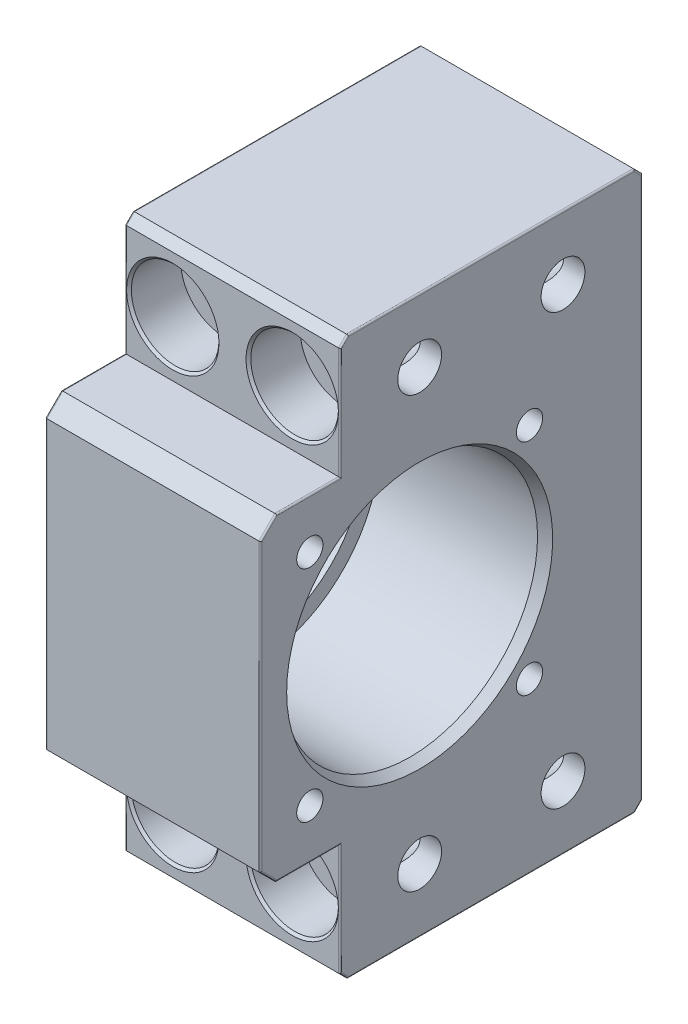
from build123d import *

# Parameters (mm, degrees)
SKETCH1_W                                    = 70
SKETCH1_H                                    = 48
BOSS_EXTRUDE1_DEPTH                          = 27
SKETCH2_W                                    = 10
SKETCH2_H                                    = 15
CUT_EXTRUDE1_DEPTH                           = 51.29910536
HOLE1_D                                      = 28
HOLE1_CBORE_D                                = 32
HOLE1_CBORE_DEPTH                            = 21
F_5_5_5_5_DIAMETER_HOLE1_D                   = 5.5
CBORE_FOR_M6_HEX_SOCKET_THIN_HEAD_CA_2_COUNT = 2
CBORE_FOR_M6_HEX_SOCKET_THIN_HEAD_CA_2_PITCH = 15
CBORE_FOR_M6_HEX_SOCKET_THIN_HEAD_CA_3_COUNT = 2
CBORE_FOR_M6_HEX_SOCKET_THIN_HEAD_CA_3_PITCH = 56.044625077
CBORE_FOR_M6_HEX_SOCKET_THIN_HEAD_CA_4_COUNT = 2
CBORE_FOR_M6_HEX_SOCKET_THIN_HEAD_CA_4_PITCH = 54
TAP_DRILL_FOR_M4X0_7_TAP1_D                  = 3.3
TAP_DRILL_FOR_M4X0_7_TAP1_DEPTH              = 12
TAP_DRILL_FOR_M4X0_7_TAP1_TIP                = 0.858935633
CHAMFER1_SIZE                                = 1
CHAMFER3_SIZE                                = 2
CHAMFER2_SIZE                                = 0.7
CHAMFER2_SIZE2                               = 1.2
CHAMFER4_SIZE                                = 0.5
FILLET1_R                                    = 0.2


with BuildPart() as part:
    # Sketch1 → Boss-Extrude1 (new body)
    with BuildSketch(Plane(origin=(-13.5, 0, 0), x_dir=(0, -1, 0), z_dir=(-1, 0, 0))):
        Rectangle(SKETCH1_W, SKETCH1_H)
    extrude(amount=-BOSS_EXTRUDE1_DEPTH)

    # Sketch2 → Cut-Extrude1 (cut, through all)
    with BuildSketch(Plane(origin=(13.5, 0, 0), x_dir=(0, 0, -1), z_dir=(1, 0, 0))):
        with Locations((-19, 27.5)):
            Rectangle(SKETCH2_W, SKETCH2_H)
        with Locations((-19, -27.5)):
            Rectangle(SKETCH2_W, SKETCH2_H)
    extrude(amount=-CUT_EXTRUDE1_DEPTH, mode=Mode.SUBTRACT)

    # Hole1 (through all)
    with Locations(Plane(origin=(13.5, 0, 0), x_dir=(0, 0, -1), z_dir=(1, 0, 0))):
        with Locations((-4, 0)):
            CounterBoreHole(HOLE1_D / 2, HOLE1_CBORE_D / 2, HOLE1_CBORE_DEPTH)

    # Ø5.5 (5.5) Diameter Hole1 (through all)
    with Locations(Plane.ZY.offset(13.5)):
        with Locations((4, 27), (-14, 27), (4, -27), (-14, -27)):
            Hole(F_5_5_5_5_DIAMETER_HOLE1_D / 2)

    # Sketch8 → CBORE for M6 Hex Socket Thin Head Cap Screw1 (revolve, cut)
    with BuildSketch(Plane(origin=(-7.5, -27, 14), x_dir=(0, -1, 0), z_dir=(1, 0, 0))):
        Polygon((0, 0), (0, 38), (3.6, 38), (3.3, 37.7), (3.3, 6.5), (5.5, 6.5), (5.5, 0.3), (5.8, 0), align=None)
    cbore_for_m6_hex_socket_thin_head_cap_sc = revolve(axis=Axis((-7.5, -27, 20.35), (0, 0, -1)), mode=Mode.SUBTRACT)

    # CBORE for M6 Hex Socket Thin Head Ca 2: CBORE for M6 Hex Socket Thin Head Cap Screw1 ×2
    with Locations(*[(i * CBORE_FOR_M6_HEX_SOCKET_THIN_HEAD_CA_2_PITCH, 0, 0) for i in range(1, CBORE_FOR_M6_HEX_SOCKET_THIN_HEAD_CA_2_COUNT)]):
        add(cbore_for_m6_hex_socket_thin_head_cap_sc, mode=Mode.SUBTRACT)

    # CBORE for M6 Hex Socket Thin Head Ca 3: CBORE for M6 Hex Socket Thin Head Cap Screw1 ×2
    with Locations(*[Vector(0.26764386378609467, 0.9635179096299407, 0) * (i * CBORE_FOR_M6_HEX_SOCKET_THIN_HEAD_CA_3_PITCH) for i in range(1, CBORE_FOR_M6_HEX_SOCKET_THIN_HEAD_CA_3_COUNT)]):
        add(cbore_for_m6_hex_socket_thin_head_cap_sc, mode=Mode.SUBTRACT)

    # CBORE for M6 Hex Socket Thin Head Ca 4: CBORE for M6 Hex Socket Thin Head Cap Screw1 ×2
    with Locations(*[(0, i * CBORE_FOR_M6_HEX_SOCKET_THIN_HEAD_CA_4_PITCH, 0) for i in range(1, CBORE_FOR_M6_HEX_SOCKET_THIN_HEAD_CA_4_COUNT)]):
        add(cbore_for_m6_hex_socket_thin_head_cap_sc, mode=Mode.SUBTRACT)

    # Tap Drill for M4x0.7 Tap1
    with Locations(Plane(origin=(13.5, 0, 0), x_dir=(0, 0, 1), z_dir=(1, 0, 0))):
        with Locations((-9.788582233, -13.788582233), (17.788582233, -13.788582233), (17.788582233, 13.788582233), (-9.788582233, 13.788582233)):
            Hole(TAP_DRILL_FOR_M4X0_7_TAP1_D / 2, depth=TAP_DRILL_FOR_M4X0_7_TAP1_DEPTH)
            with Locations((0, 0, -(TAP_DRILL_FOR_M4X0_7_TAP1_DEPTH + TAP_DRILL_FOR_M4X0_7_TAP1_TIP / 2))):  # 125° drill point
                Cone(0, TAP_DRILL_FOR_M4X0_7_TAP1_D / 2, TAP_DRILL_FOR_M4X0_7_TAP1_TIP, mode=Mode.SUBTRACT)

    # Chamfer1
    chamfer1_edges = [part.edges().sort_by_distance(p)[0] for p in [
        (0, 35, 14),
        (0, -35, 14),
        (0, -35, -24),
        (0, 35, -24),
    ]]
    chamfer(chamfer1_edges, length=CHAMFER1_SIZE)

    # Chamfer3
    chamfer3_edges = [part.edges().sort_by_distance(p)[0] for p in [
        (0, 20, 24),
        (0, -20, 24),
    ]]
    chamfer(chamfer3_edges, length=CHAMFER3_SIZE)

    # Chamfer2
    chamfer2_edges = [part.edges().sort_by_distance(p)[0] for p in [
        (13.5, 0, 20),
    ]]
    chamfer2_side = [part.faces().sort_by_distance(p)[0] for p in [
        (13.5, -19.151236193, 18),
    ]]
    chamfer(chamfer2_edges, length=CHAMFER2_SIZE, length2=CHAMFER2_SIZE2, reference=chamfer2_side[0])

    # Chamfer4
    chamfer4_edges = [part.edges().sort_by_distance(p)[0] for p in [
        (-13.5, 0, -10),
    ]]
    chamfer(chamfer4_edges, length=CHAMFER4_SIZE)

    # Fillet1
    fillet1_edges = [part.edges().sort_by_distance(p)[0] for p in [
        (-13.5, 0, -24),
        (13.5, 0, -24),
        (-13.5, 35, -5),
        (-13.5, -35, -5),
        (-13.5, -27, 14),
        (-13.5, 34.5, 13.5),
        (-13.5, 34.5, -23.5),
        (-13.5, -34.5, 13.5),
        (-13.5, -34.5, -23.5),
        (13.5, -35, -5),
        (13.5, -27, 14),
        (13.5, 35, -5),
        (13.5, 34.5, 13.5),
        (13.5, 34.5, -23.5),
        (13.5, -34.5, 13.5),
        (13.5, -34.5, -23.5),
        (-13.5, 27, 14),
        (13.5, 0, 24),
        (-13.5, 0, 24),
        (13.5, 20, 18),
        (13.5, 19, 23),
        (13.5, -19, 23),
        (-13.5, 20, 18),
        (-13.5, 19, 23),
        (-13.5, -19, 23),
        (13.5, 27, 14),
        (-13.5, -20, 18),
        (13.5, -20, 18),
    ]]
    fillet(fillet1_edges, radius=FILLET1_R - 0.0001)  # a hair under: the kernel refuses the full size


solid = part.part
